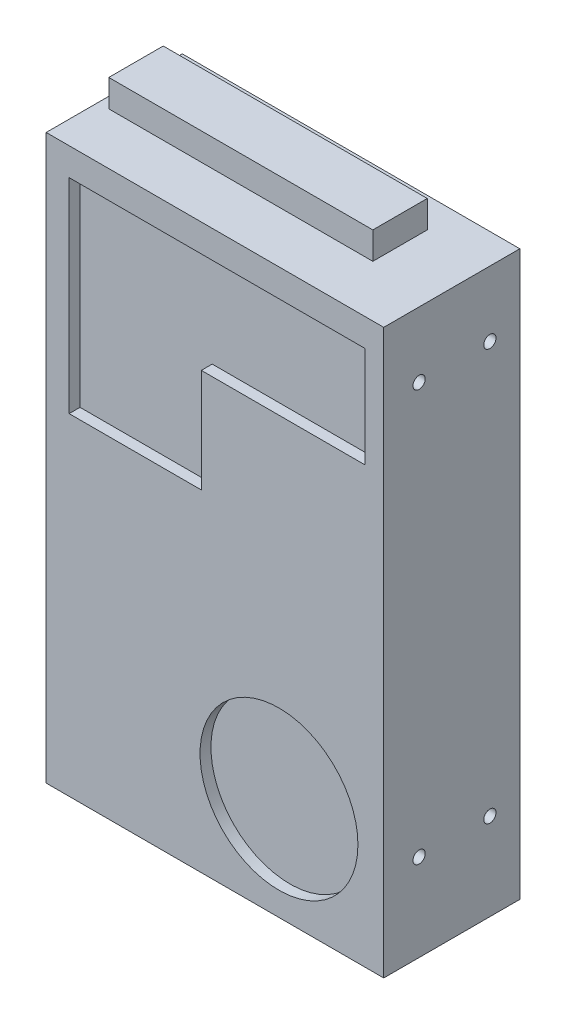
from build123d import *

# Parameters (mm, degrees)
SKETCH1_W           = 124
SKETCH1_H           = 225
BOSS_EXTRUDE1_DEPTH = 50
SKETCH2_W           = 142.142792237
SKETCH2_H           = 18
CUT_EXTRUDE1_DEPTH  = 50
SKETCH3_W           = 97
SKETCH3_H           = 20
BOSS_EXTRUDE2_DEPTH = 10
SKETCH4_R           = 29
CUT_EXTRUDE3_DEPTH  = 4
SKETCH5_R           = 2.25
CUT_EXTRUDE4_DEPTH  = 15
SKETCH6_R           = 2.25
CUT_EXTRUDE5_DEPTH  = 175.734799053


with BuildPart() as part:
    # Sketch1 → Boss-Extrude1 (new body)
    with BuildSketch(Plane.XY):
        Rectangle(SKETCH1_W, SKETCH1_H)
    extrude(amount=BOSS_EXTRUDE1_DEPTH)

    # Sketch2 → Cut-Extrude1 (cut)
    with BuildSketch(Plane.XY.offset(50)):
        with Locations((-0.947920956, 103.5)):
            Rectangle(SKETCH2_W, SKETCH2_H)
    extrude(amount=-CUT_EXTRUDE1_DEPTH, mode=Mode.SUBTRACT)

    # Sketch3 → Boss-Extrude2 (add)
    with BuildSketch(Plane(origin=(0, 94.5, 0), x_dir=(1, 0, 0), z_dir=(0, 1, 0))):
        with Locations((-9.5, -21)):
            Rectangle(SKETCH3_W, SKETCH3_H)
    extrude(amount=BOSS_EXTRUDE2_DEPTH)

    # Sketch4 → Cut-Extrude3 (cut)
    with BuildSketch(Plane.XY.offset(50)):
        with Locations((23.52502673, -74.82534643)):
            Circle(SKETCH4_R)
        Polygon((-53.556975746, 84.343983357), (55.058573197, 84.343983357), (55.058573197, 47.30457957), (-5.005324836, 47.30457957), (-5.005324836, 9.264110816), (-53.556975746, 9.264110816), align=None)
    extrude(amount=-CUT_EXTRUDE3_DEPTH, mode=Mode.SUBTRACT)

    # Sketch5 → Cut-Extrude4 (cut)
    with BuildSketch(Plane(origin=(0, 0, 0), x_dir=(-1, 0, 0), z_dir=(0, 0, -1))):
        with Locations((-25, 70.5)):
            Circle(SKETCH5_R)
        with Locations((25, 70.5)):
            Circle(SKETCH5_R)
        with Locations((25, -80.5)):
            Circle(SKETCH5_R)
        with Locations((-25, -80.5)):
            Circle(SKETCH5_R)
    extrude(amount=-CUT_EXTRUDE4_DEPTH, mode=Mode.SUBTRACT)

    # Sketch6 → Cut-Extrude5 (cut, through all)
    with BuildSketch(Plane.ZY.offset(62)):
        with Locations((11, 70.5)):
            Circle(SKETCH6_R)
        with Locations((37, 70.5)):
            Circle(SKETCH6_R)
        with Locations((37, -80.5)):
            Circle(SKETCH6_R)
        with Locations((11, -80.5)):
            Circle(SKETCH6_R)
    extrude(amount=-CUT_EXTRUDE5_DEPTH, mode=Mode.SUBTRACT)


solid = part.part
